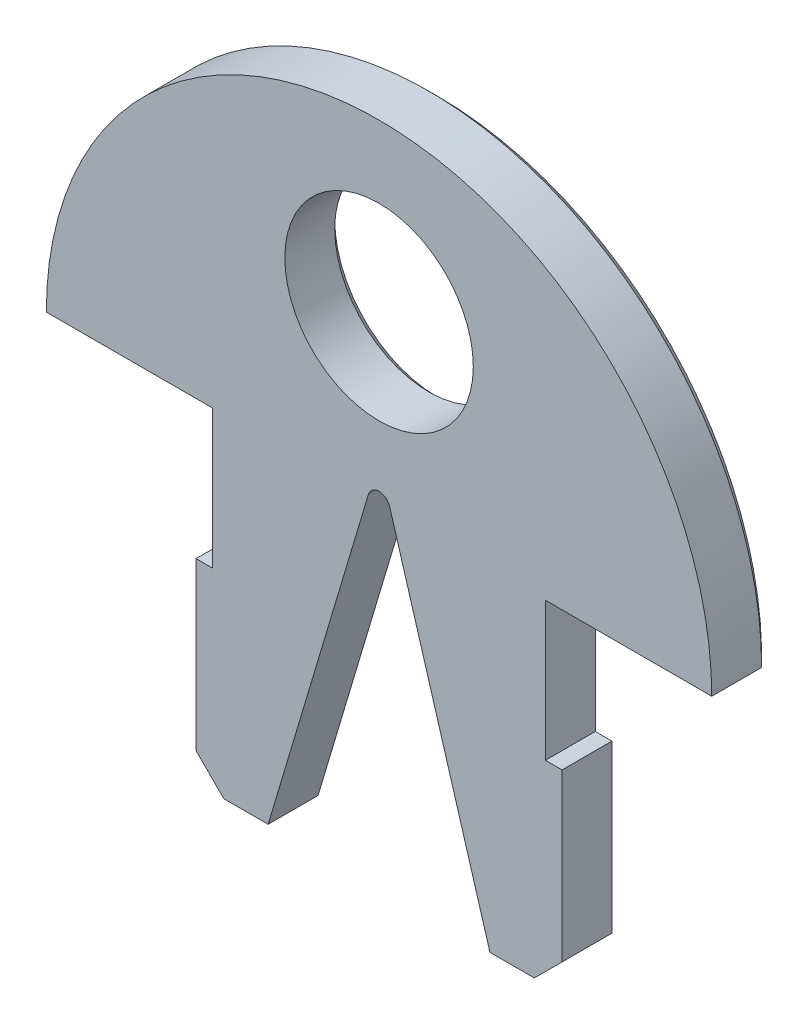
from build123d import *

# Parameters (mm, degrees)
SKETCH1_R           = 3.399254874
BOSS_EXTRUDE1_DEPTH = 2.1
CHAMFER1_SIZE       = 1
CHAMFER2_SIZE       = 0.3


with BuildPart() as part:
    # Sketch1 → Boss-Extrude1 (new body)
    with BuildSketch(Plane.XY):
        with BuildLine():
            Line((6, 6), (12, 6))
            ThreePointArc((12, 6), (0, 18), (-12, 6))
            Line((-12, 6), (-6, 6))
            Line((-6, 6), (-6, 1))
            Line((-6, 1), (-6.6, 1))
            Line((-6.6, 1), (-6.6, -6))
            Line((-6.6, -6), (-6, -6))
            Line((-6, -6), (-4, -6))
            Line((-4, -6), (-0.383283535, 6.114427845))
            ThreePointArc((-0.383283535, 6.114427845), (0, 6.4), (0.383283535, 6.114427845))
            Line((0.383283535, 6.114427845), (4, -6))
            Line((4, -6), (6, -6))
            Line((6, -6), (6.6, -6))
            Line((6.6, -6), (6.6, 1))
            Line((6.6, 1), (6, 1))
            Line((6, 1), (6, 6))
        make_face()
        with Locations((0, 12)):
            Circle(SKETCH1_R, mode=Mode.SUBTRACT)
    extrude(amount=BOSS_EXTRUDE1_DEPTH)

    # Chamfer1
    chamfer1_edges = [part.edges().sort_by_distance(p)[0] for p in [
        (6.6, -6, 1.05),
        (-6.6, -6, 1.05),
    ]]
    chamfer(chamfer1_edges, length=CHAMFER1_SIZE)

    # Chamfer2
    chamfer2_edges = [part.edges().sort_by_distance(p)[0] for p in [
        (-3.399254874, 12, 0),
        (6.3, 1, 0),
        (6, 3.5, 0),
        (9, 6, 0),
        (0, 18, 0),
        (-9, 6, 0),
        (-6, 3.5, 0),
        (-6.3, 1, 0),
        (-6.6, -2, 0),
        (-6.1, -5.5, 0),
        (-4.8, -6, 0),
        (-2.191641768, 0.057213923, 0),
        (0, 6.4, 0),
        (2.191641768, 0.057213923, 0),
        (4.8, -6, 0),
        (6.1, -5.5, 0),
        (6.6, -2, 0),
    ]]
    chamfer(chamfer2_edges, length=CHAMFER2_SIZE)


solid = part.part
